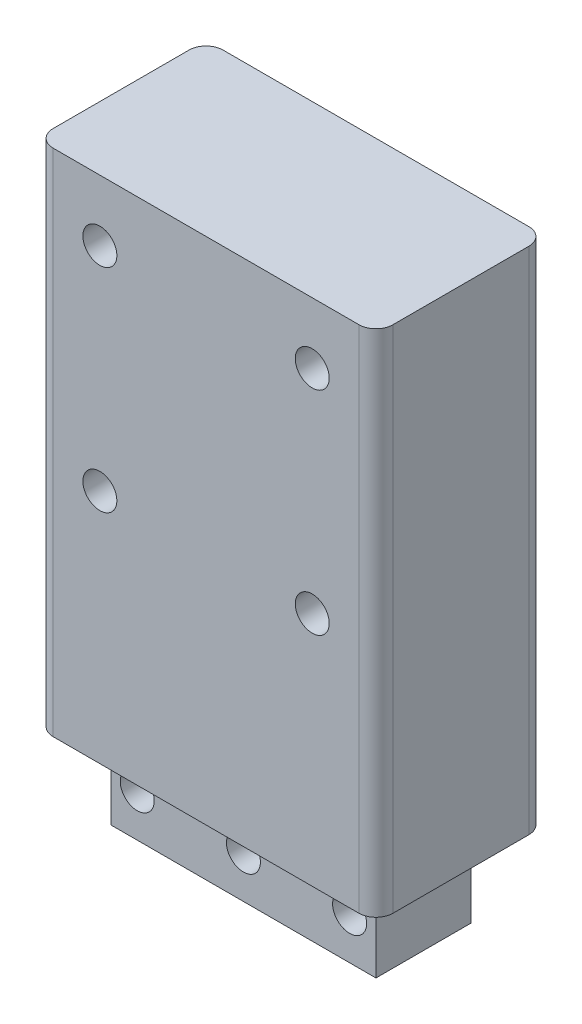
from build123d import *

# Parameters (mm, degrees)
SKETCH1_W           = 40
SKETCH1_H           = 20
BOSS_EXTRUDE1_DEPTH = 20
SKETCH3_W           = 40
SKETCH3_H           = 20
BOSS_EXTRUDE2_DEPTH = 40
SKETCH4_W           = 31.2
SKETCH4_H           = 11.2
BOSS_EXTRUDE3_DEPTH = 10
SKETCH5_R           = 2
CUT_EXTRUDE1_DEPTH  = 35
SKETCH6_R           = 2
CUT_EXTRUDE2_DEPTH  = 35
FILLET2_R           = 2


with BuildPart() as part:
    # Sketch1 → Boss-Extrude1 (new body)
    with BuildSketch(Plane(origin=(0, 0, 0), x_dir=(1, 0, 0), z_dir=(0, 1, 0))):
        Rectangle(SKETCH1_W, SKETCH1_H)
    extrude(amount=-BOSS_EXTRUDE1_DEPTH)

    # Sketch3 → Boss-Extrude2 (add)
    with BuildSketch(Plane(origin=(0, 0, 0), x_dir=(1, 0, 0), z_dir=(0, 1, 0))):
        Rectangle(SKETCH3_W, SKETCH3_H)
    extrude(amount=BOSS_EXTRUDE2_DEPTH)

    # Sketch4 → Boss-Extrude3 (add)
    with BuildSketch(Plane.XZ.offset(20)):
        Rectangle(SKETCH4_W, SKETCH4_H)
    extrude(amount=BOSS_EXTRUDE3_DEPTH)

    # Sketch5 → Cut-Extrude1 (cut, symmetric)
    with BuildSketch(Plane(origin=(0, 0, -5.6), x_dir=(-1, 0, 0), z_dir=(0, 0, -1))):
        with Locations((0, -25)):
            Circle(SKETCH5_R)
        with Locations((12.5, -25)):
            Circle(SKETCH5_R)
        with Locations((-12.5, -25)):
            Circle(SKETCH5_R)
    extrude(amount=CUT_EXTRUDE1_DEPTH, both=True, mode=Mode.SUBTRACT)

    # Sketch6 → Cut-Extrude2 (cut)
    with BuildSketch(Plane(origin=(0, 0, -10), x_dir=(-1, 0, 0), z_dir=(0, 0, -1))):
        with Locations((12.5, 7.800844988)):
            Circle(SKETCH6_R)
        with Locations((12.5, 32.800844988)):
            Circle(SKETCH6_R)
        with Locations((-12.5, 32.800844988)):
            Circle(SKETCH6_R)
        with Locations((-12.5, 7.800844988)):
            Circle(SKETCH6_R)
    extrude(amount=-CUT_EXTRUDE2_DEPTH, mode=Mode.SUBTRACT)

    # Fillet2
    fillet2_edges = [part.edges().sort_by_distance(p)[0] for p in [
        (20, 10, -10),
        (20, 10, 10),
        (-20, 10, 10),
        (-20, 10, -10),
    ]]
    fillet(fillet2_edges, radius=FILLET2_R)


solid = part.part
